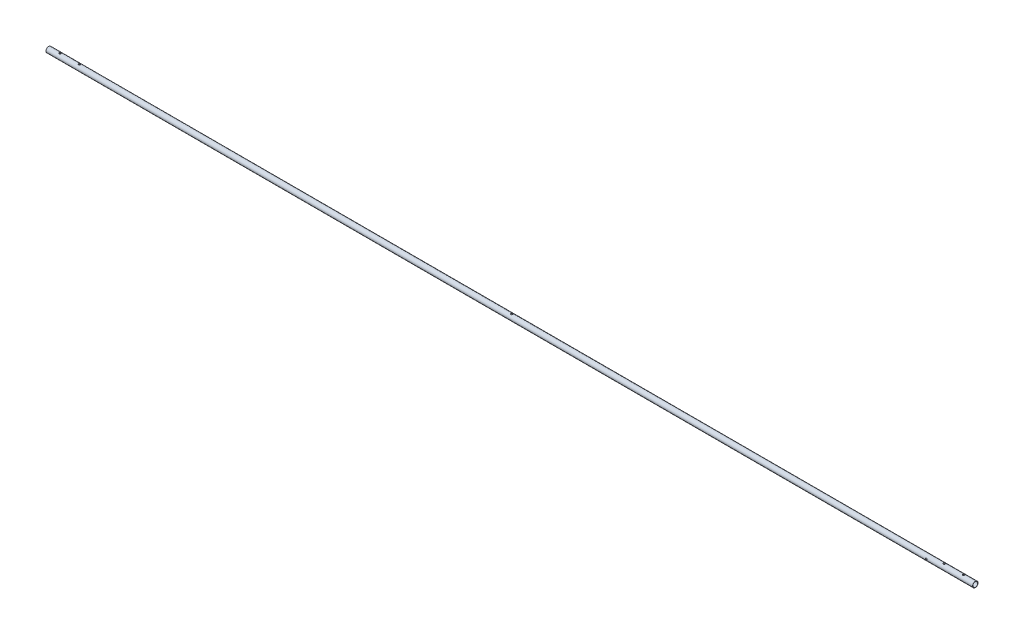
from build123d import *

# Parameters (mm, degrees)
SKETCH1_R               = 8.9662
SKETCH1_R_2             = 7.8994
BOSS_EXTRUDE1_DEPTH     = 3048
CUT_EXTRUDE2_DEPTH      = 3049.026375458
CUT_EXTRUDE2_DEPTH_BACK = 3049.026375458
SKETCH3_R               = 3.175
CUT_EXTRUDE5_DEPTH      = 3049.026375558
CUT_EXTRUDE5_DEPTH_BACK = 3049.026375558
SKETCH2_R               = 3.175
CUT_EXTRUDE6_DEPTH      = 3049.026375558
CUT_EXTRUDE6_DEPTH_BACK = 3049.026375558
SKETCH4_R               = 3.175


with BuildPart() as part:
    # Sketch1 → Boss-Extrude1 (new body)
    with BuildSketch(Plane(origin=(0, 0, 0), x_dir=(0, 0, -1), z_dir=(1, 0, 0))):
        Circle(SKETCH1_R)
        Circle(SKETCH1_R_2, mode=Mode.SUBTRACT)
    extrude(amount=BOSS_EXTRUDE1_DEPTH)

    # Sketch3 → Cut-Extrude2 (cut, two sides: drawn at the far end of the back side and taken through both)
    with BuildSketch(Plane(origin=(0, 0, 0), x_dir=(1, 0, 0), z_dir=(0, 1, 0)).offset(-CUT_EXTRUDE2_DEPTH_BACK)):
        with Locations((1524, 0)):
            Circle(SKETCH3_R)
    extrude(amount=CUT_EXTRUDE2_DEPTH + CUT_EXTRUDE2_DEPTH_BACK, mode=Mode.SUBTRACT)

    # Sketch2 → Cut-Extrude5 (cut, two sides: drawn at the far end of the back side and taken through both)
    with BuildSketch(Plane(origin=(0, 0, 0), x_dir=(1, 0, 0), z_dir=(0, 1, 0)).offset(-CUT_EXTRUDE5_DEPTH_BACK)):
        with Locations((38.1, 0)):
            Circle(SKETCH2_R)
        with Locations((3009.9, 0)):
            Circle(SKETCH2_R)
        with Locations((101.6, 0)):
            Circle(SKETCH2_R)
        with Locations((2946.4, 0)):
            Circle(SKETCH2_R)
    extrude(amount=CUT_EXTRUDE5_DEPTH + CUT_EXTRUDE5_DEPTH_BACK, mode=Mode.SUBTRACT)

    # Sketch4 → Cut-Extrude6 (cut, two sides: drawn at the far end of the back side and taken through both)
    with BuildSketch(Plane.XY.offset(-CUT_EXTRUDE6_DEPTH_BACK)):
        with Locations((2895.6, 0)):
            Circle(SKETCH4_R)
    extrude(amount=CUT_EXTRUDE6_DEPTH + CUT_EXTRUDE6_DEPTH_BACK, mode=Mode.SUBTRACT)


solid = part.part
